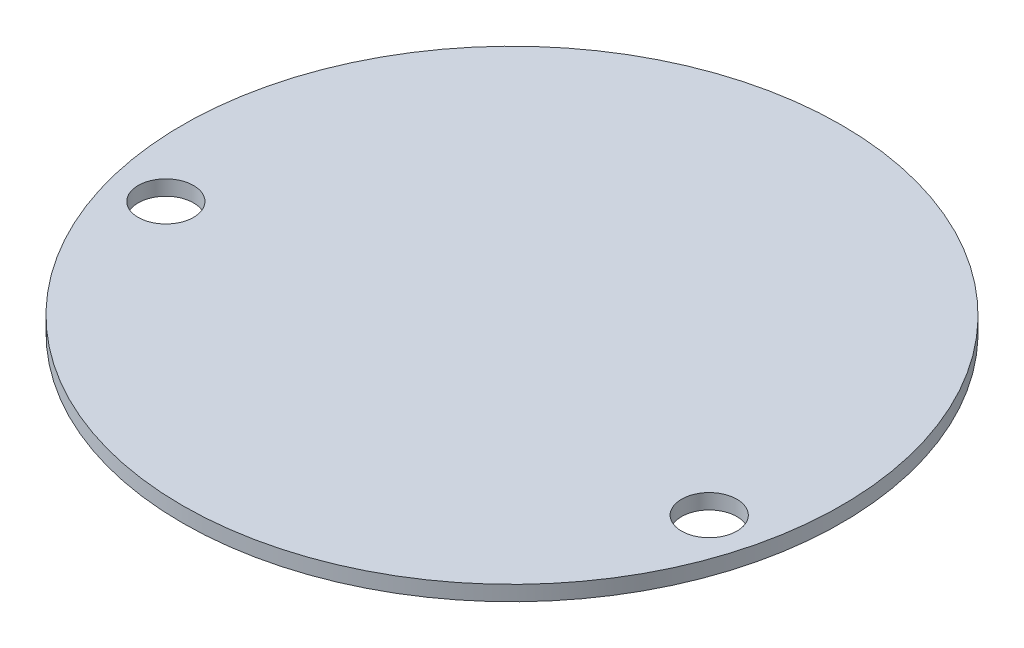
from build123d import *

# Parameters (mm, degrees)
SKETCH1_R           = 32.75
SKETCH1_R_2         = 2.75
BOSS_EXTRUDE1_DEPTH = 1.5


with BuildPart() as part:
    # Sketch1 → Boss-Extrude1 (new body)
    with BuildSketch(Plane(origin=(0, 0, 0), x_dir=(1, 0, 0), z_dir=(0, 1, 0))):
        Circle(SKETCH1_R)
        with Locations((-27, -7.4)):
            Circle(SKETCH1_R_2, mode=Mode.SUBTRACT)
        with Locations((27, -7.4)):
            Circle(SKETCH1_R_2, mode=Mode.SUBTRACT)
    extrude(amount=BOSS_EXTRUDE1_DEPTH)


solid = part.part
